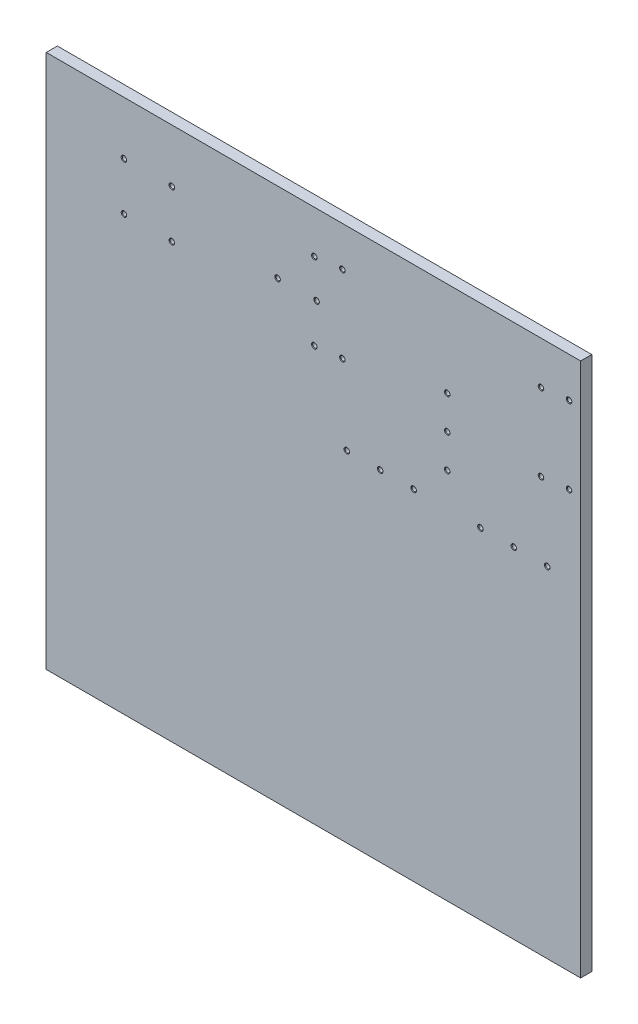
from build123d import *

# Parameters (mm, degrees)
SKETCH1_W                            = 304.8
SKETCH1_H                            = 304.8
BOSS_EXTRUDE1_DEPTH                  = 12.7
SKETCH2_W                            = 12.7
SKETCH2_H                            = 304.8
BOSS_EXTRUDE2_DEPTH                  = 304.8
SKETCH3_W                            = 609.6
SKETCH3_H                            = 12.7
BOSS_EXTRUDE3_DEPTH                  = 254
SKETCH4_W                            = 609.6
SKETCH4_H                            = 12.7
BOSS_EXTRUDE4_DEPTH                  = 50.8
F_8_0_199_DIAMETER_HOLE2_D           = 5.0546
F_8_0_199_DIAMETER_HOLE2_DEPTH       = 8.382
F_8_0_199_DIAMETER_HOLE2_CSINK_D     = 6.3246
F_8_0_199_DIAMETER_HOLE2_CSINK_ANGLE = 90
F_8_0_199_DIAMETER_HOLE2_TIP         = 1.518555042
F_8_0_199_DIAMETER_HOLE3_AT_2_COUNT  = 2
F_8_0_199_DIAMETER_HOLE3_AT_2_PITCH  = 32.173890346
LPATTERN1_COUNT                      = 2
LPATTERN1_PITCH                      = 258.572
LPATTERN1_COUNT_DIR2                 = 2
LPATTERN1_PITCH_DIR2                 = 88.138
F_8_0_199_DIAMETER_HOLE4_D           = 5.0546
F_8_0_199_DIAMETER_HOLE4_DEPTH       = 8.382
F_8_0_199_DIAMETER_HOLE4_CSINK_D     = 6.3246
F_8_0_199_DIAMETER_HOLE4_CSINK_ANGLE = 90
F_8_0_199_DIAMETER_HOLE4_TIP         = 1.518555042
F_8_0_199_DIAMETER_HOLE6_D           = 5.0546
F_8_0_199_DIAMETER_HOLE6_DEPTH       = 8.382
F_8_0_199_DIAMETER_HOLE6_CSINK_D     = 6.3246
F_8_0_199_DIAMETER_HOLE6_CSINK_ANGLE = 90
F_8_0_199_DIAMETER_HOLE6_TIP         = 1.518555042


with BuildPart() as part:
    # Sketch1 → Boss-Extrude1 (new body)
    with BuildSketch(Plane.XY):
        with Locations((-60.739130435, 60.186956522)):
            Rectangle(SKETCH1_W, SKETCH1_H)
    extrude(amount=BOSS_EXTRUDE1_DEPTH)

    # Sketch2 → Boss-Extrude2 (add)
    with BuildSketch(Plane.ZY.offset(213.139130435)):
        with Locations((6.35, 60.186956522)):
            Rectangle(SKETCH2_W, SKETCH2_H)
    extrude(amount=BOSS_EXTRUDE2_DEPTH)

    # Sketch3 → Boss-Extrude3 (add)
    with BuildSketch(Plane.XZ.offset(92.213043478)):
        with Locations((-213.139130435, 6.35)):
            Rectangle(SKETCH3_W, SKETCH3_H)
    extrude(amount=BOSS_EXTRUDE3_DEPTH)

    # Sketch4 → Boss-Extrude4 (add)
    with BuildSketch(Plane(origin=(0, 212.586956522, 0), x_dir=(1, 0, 0), z_dir=(0, 1, 0))):
        with Locations((-213.139130435, -6.35)):
            Rectangle(SKETCH4_W, SKETCH4_H)
    extrude(amount=BOSS_EXTRUDE4_DEPTH)

    # #8 (0.199) Diameter Hole2
    with Locations(Plane.XY.offset(12.7)):
        with Locations((53.560869565, 41.390956522), (15.460869565, 41.390956522), (-22.639130435, 41.390956522), (-98.839130435, 41.390956522), (-136.939130435, 41.390956522), (-175.039130435, 41.390956522), (-60.485130435, 79.236956522), (-60.485130435, 117.336956522), (-60.485130435, 155.436956522)):
            CounterSinkHole(F_8_0_199_DIAMETER_HOLE2_D / 2, F_8_0_199_DIAMETER_HOLE2_CSINK_D / 2, depth=F_8_0_199_DIAMETER_HOLE2_DEPTH, counter_sink_angle=F_8_0_199_DIAMETER_HOLE2_CSINK_ANGLE)
            with Locations((0, 0, -(F_8_0_199_DIAMETER_HOLE2_DEPTH + F_8_0_199_DIAMETER_HOLE2_TIP / 2))):  # 118° drill point
                Cone(0, F_8_0_199_DIAMETER_HOLE2_D / 2, F_8_0_199_DIAMETER_HOLE2_TIP, mode=Mode.SUBTRACT)

    # Sketch15 → #8 (0.199) Diameter Hole3 (revolve, cut)
    with BuildSketch(Plane(origin=(78.452869565, 217.920956522, 12.7), x_dir=(0, -1, 0), z_dir=(1, 0, 0))):
        Polygon((0, 0), (0, 9.900555042), (2.5273, 8.382), (2.5273, 0.635), (3.1623, 0), align=None)
    f_8_0_199_diameter_hole3 = revolve(axis=Axis((78.452869565, 217.920956522, 19.05), (0, 0, -1)), mode=Mode.SUBTRACT)

    # #8 (0.199) Diameter Hole3 at 2: #8 (0.199) Diameter Hole3 ×2
    with Locations(*[Vector(-0.994719620654259, -0.102629802130995, 0) * (i * F_8_0_199_DIAMETER_HOLE3_AT_2_PITCH) for i in range(1, F_8_0_199_DIAMETER_HOLE3_AT_2_COUNT)]):
        add(f_8_0_199_diameter_hole3, mode=Mode.SUBTRACT)

    # LPattern1: 8 _0.199_ Diameter Hole3 2 × 2
    with Locations(*[(-i * LPATTERN1_PITCH, -j * LPATTERN1_PITCH_DIR2, 0) for i in range(LPATTERN1_COUNT) for j in range(LPATTERN1_COUNT_DIR2) if (i, j) != (0, 0)]):
        add(f_8_0_199_diameter_hole3, mode=Mode.SUBTRACT)

    # LPattern1 copy 1 sketch → LPattern1 copy 1 (revolve, cut)
    with BuildSketch(Plane(origin=(46.448869565, 126.480956522, 12.7), x_dir=(0, -1, 0), z_dir=(1, 0, 0))):
        Polygon((0, 0), (0, 9.900555042), (2.5273, 8.382), (2.5273, 0.635), (3.1623, 0), align=None)
    revolve(axis=Axis((46.448869565, 126.480956522, 19.05), (0, 0, -1)), mode=Mode.SUBTRACT)

    # LPattern1 copy 2 sketch → LPattern1 copy 2 (revolve, cut)
    with BuildSketch(Plane(origin=(-212.123130435, 214.618956522, 12.7), x_dir=(0, -1, 0), z_dir=(1, 0, 0))):
        Polygon((0, 0), (0, 9.900555042), (2.5273, 8.382), (2.5273, 0.635), (3.1623, 0), align=None)
    revolve(axis=Axis((-212.123130435, 214.618956522, 19.05), (0, 0, -1)), mode=Mode.SUBTRACT)

    # LPattern1 copy 3 sketch → LPattern1 copy 3 (revolve, cut)
    with BuildSketch(Plane(origin=(-212.123130435, 126.480956522, 12.7), x_dir=(0, -1, 0), z_dir=(1, 0, 0))):
        Polygon((0, 0), (0, 9.900555042), (2.5273, 8.382), (2.5273, 0.635), (3.1623, 0), align=None)
    revolve(axis=Axis((-212.123130435, 126.480956522, 19.05), (0, 0, -1)), mode=Mode.SUBTRACT)

    # #8 (0.199) Diameter Hole4
    with Locations(Plane.XY.offset(12.7)):
        with Locations((-209.583130435, 172.200956522), (-254.033130435, 172.200956522)):
            CounterSinkHole(F_8_0_199_DIAMETER_HOLE4_D / 2, F_8_0_199_DIAMETER_HOLE4_CSINK_D / 2, depth=F_8_0_199_DIAMETER_HOLE4_DEPTH, counter_sink_angle=F_8_0_199_DIAMETER_HOLE4_CSINK_ANGLE)
            with Locations((0, 0, -(F_8_0_199_DIAMETER_HOLE4_DEPTH + F_8_0_199_DIAMETER_HOLE4_TIP / 2))):  # 118° drill point
                Cone(0, F_8_0_199_DIAMETER_HOLE4_D / 2, F_8_0_199_DIAMETER_HOLE4_TIP, mode=Mode.SUBTRACT)

    # #8 (0.199) Diameter Hole6
    with Locations(Plane.XY.offset(12.7)):
        with Locations((-374.683130435, 202.680956522), (-429.293130435, 202.680956522), (-374.683130435, 148.070956522), (-429.293130435, 148.070956522)):
            CounterSinkHole(F_8_0_199_DIAMETER_HOLE6_D / 2, F_8_0_199_DIAMETER_HOLE6_CSINK_D / 2, depth=F_8_0_199_DIAMETER_HOLE6_DEPTH, counter_sink_angle=F_8_0_199_DIAMETER_HOLE6_CSINK_ANGLE)
            with Locations((0, 0, -(F_8_0_199_DIAMETER_HOLE6_DEPTH + F_8_0_199_DIAMETER_HOLE6_TIP / 2))):  # 118° drill point
                Cone(0, F_8_0_199_DIAMETER_HOLE6_D / 2, F_8_0_199_DIAMETER_HOLE6_TIP, mode=Mode.SUBTRACT)


solid = part.part
